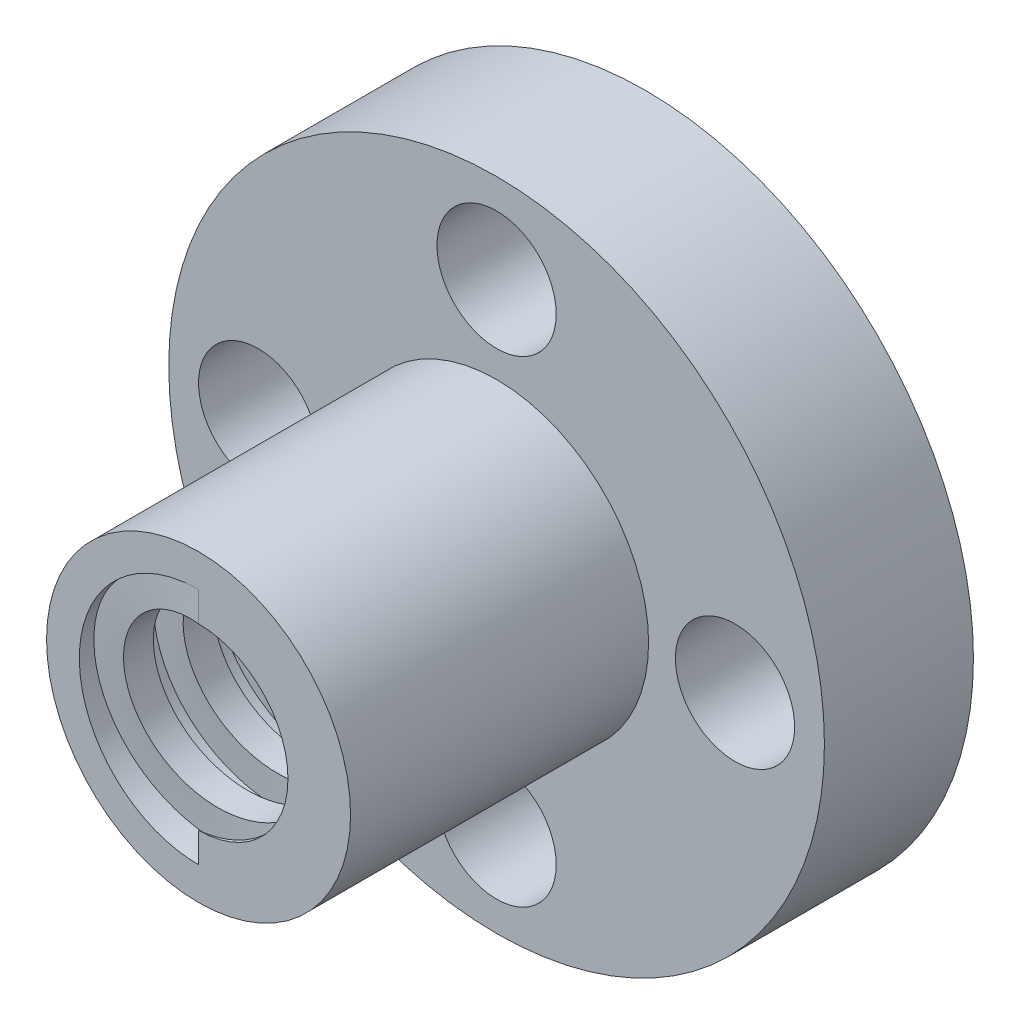
from build123d import *

# Parameters (mm, degrees)
SKETCH1_R           = 11
BOSS_EXTRUDE1_DEPTH = 5
SKETCH2_R           = 5.1
BOSS_EXTRUDE2_DEPTH = 10
SKETCH3_R           = 3
CUT_EXTRUDE1_DEPTH  = 22.610182785
CUT_SWEEP1_PITCH    = 2
SKETCH6_R           = 2
CUT_EXTRUDE2_DEPTH  = 19.493242182


with BuildPart() as part:
    # Sketch1 → Boss-Extrude1 (new body)
    with BuildSketch(Plane.XY):
        Circle(SKETCH1_R)
    extrude(amount=BOSS_EXTRUDE1_DEPTH)

    # Sketch2 → Boss-Extrude2 (add)
    with BuildSketch(Plane.XY.offset(5)):
        Circle(SKETCH2_R)
    extrude(amount=BOSS_EXTRUDE2_DEPTH)

    # Sketch3 → Cut-Extrude1 (cut, through all)
    with BuildSketch(Plane.XY.offset(15)):
        Circle(SKETCH3_R)
    extrude(amount=-CUT_EXTRUDE1_DEPTH, mode=Mode.SUBTRACT)

    # Cut-Sweep1: arcs per turn and ends read off the stored shape
    # Cut-Sweep1: the profile of Sketch5 screwed along a left-hand helix through 10 turns, 10 arcs to a turn; built about Z, then put on its axis
    cut_sweep1_z = Axis((0, 0, 0), (0, 0, 1))
    cut_sweep1_corners = [(4, 0, 0.5), (2, 0, 0.5), (2, 0, -0.5), (4, 0, -0.5)]
    with BuildLine(mode=Mode.PRIVATE) as cut_sweep1_profile:
        Line(cut_sweep1_corners[0], cut_sweep1_corners[1])
        Line(cut_sweep1_corners[1], cut_sweep1_corners[2])
        Line(cut_sweep1_corners[2], cut_sweep1_corners[3])
        Line(cut_sweep1_corners[3], cut_sweep1_corners[0])
    cut_sweep1_cap = Face(cut_sweep1_profile.wire())
    cut_sweep1_turn_angles = [0, -18, -36, -54, -72, -90, -108, -126, -144, -162, -180, -198, -216, -234, -252, -270, -288, -306, -324, -342, -360]
    cut_sweep1_turn_weights = [1, 0.9510565162951535, 1, 0.9510565162951535, 1, 0.9510565162951535, 1, 0.9510565162951535, 1, 0.9510565162951535, 1, 0.9510565162951535, 1, 0.9510565162951535, 1, 0.9510565162951535, 1, 0.9510565162951535, 1, 0.9510565162951535, 1]
    cut_sweep1_turn_rails = [Edge.make_bspline([Vector(p[0], p[1], 0).rotate(cut_sweep1_z, cut_sweep1_turn_angles[k]) / cut_sweep1_turn_weights[k] + Vector(0, 0, p[2] + -CUT_SWEEP1_PITCH * cut_sweep1_turn_angles[k] / 360) for k in range(21)], [0, 0, 0, 1, 1, 2, 2, 3, 3, 4, 4, 5, 5, 6, 6, 7, 7, 8, 8, 9, 9, 10, 10, 10], 2, cut_sweep1_turn_weights) for p in cut_sweep1_corners]
    cut_sweep1_turn_sides = [Face.make_surface_from_curves(cut_sweep1_turn_rails[p[0]], cut_sweep1_turn_rails[p[1]]) for p in [(0, 1), (1, 2), (2, 3), (3, 0)]]
    cut_sweep1 = Plane(origin=(0, 0, -3), x_dir=(-1, 0, 0), z_dir=(0, 0, 1)) * Solid(Shell([*[p.moved(Location((0, 0, CUT_SWEEP1_PITCH * i))) for i in range(10) for p in cut_sweep1_turn_sides], cut_sweep1_cap, cut_sweep1_cap.rotate(cut_sweep1_z, -3600).moved(Location((0, 0, -CUT_SWEEP1_PITCH * -3600 / 360)))]))
    add(cut_sweep1, mode=Mode.SUBTRACT)

    # Sketch6 → Cut-Extrude2 (cut, through all)
    with BuildSketch(Plane.XY.offset(5)):
        with Locations((-8, 0)):
            Circle(SKETCH6_R)
        with Locations((0, 8)):
            Circle(SKETCH6_R)
        with Locations((8, 0)):
            Circle(SKETCH6_R)
        with Locations((0, -8)):
            Circle(SKETCH6_R)
    extrude(amount=-CUT_EXTRUDE2_DEPTH, mode=Mode.SUBTRACT)


solid = part.part
